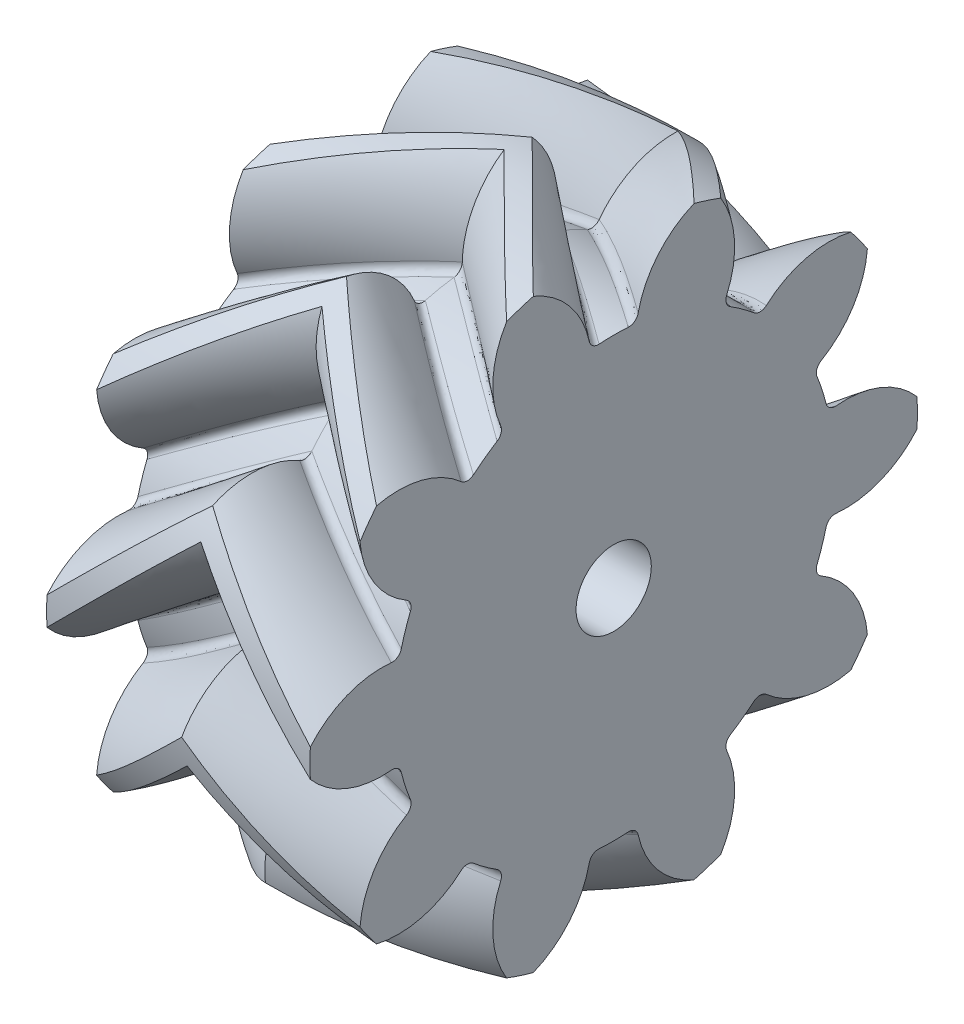
from build123d import *

# Parameters (mm, degrees)
BASPROSKE_W            = 7
BASPROSKE_H            = 16.142135624
TOOTHCUTLH_PITCH       = 101.424029378
TOOTHCUTLH_HEIGHT      = 7
TOOTHCUTLH_RADIUS      = 16.142135624
TOOTHCUTLH_START_ANGLE = -90
TEETHCUTSLH_COUNT      = 10
TEETHCUTSLH_ANGLE      = 324
BORSKE_R               = 2
BORE_DEPTH             = 62.5000025


with BuildPart() as part:
    # BasProSke → Base-Revolve (revolve)
    with BuildSketch(Plane(origin=(0, 0, 0), x_dir=(1, 0, 0), z_dir=(0, 1, 0)), mode=Mode.PRIVATE) as base_revolve_sk:
        with Locations((3.5, 8.071067812)):
            Rectangle(BASPROSKE_W, BASPROSKE_H)
    revolve(base_revolve_sk.sketch.rotate(Axis((-10, 0, 0), (1, 0, 0)), 180), axis=Axis((-10, 0, 0), (1, 0, 0)))

    # ToothCutLH: sweep along a helix
    with BuildLine() as toothcutlh_path:
        add(Helix(TOOTHCUTLH_PITCH, TOOTHCUTLH_HEIGHT, TOOTHCUTLH_RADIUS, center=(0, 0, 0), direction=(1, 0, 0), lefthand=True, mode=Mode.PRIVATE).rotate(Axis((0, 0, 0), (1, 0, 0)), TOOTHCUTLH_START_ANGLE))
    # TooCutSkeRH<3> → ToothCutLH (sweep, cut)
    with BuildSketch(Plane(origin=(0, 0, 0), x_dir=(0, 0, -1), z_dir=(1, 0, 0))):
        with BuildLine():
            ThreePointArc((0.777485713, 11.616145568), (0, 11.642135624), (-0.777485713, 11.616145568))
            ThreePointArc((-0.777485713, 11.616145568), (-1.112111143, 11.715653474), (-1.300501675, 12.009566742))
            ThreePointArc((-1.300501675, 12.009566742), (-2.640329527, 14.472142614), (-5.094931674, 15.826523243))
            ThreePointArc((-5.094931674, 15.826523243), (0, 16.626399692), (5.094931674, 15.826523243))
            ThreePointArc((5.094931674, 15.826523243), (2.640329527, 14.472142614), (1.300501675, 12.009566742))
            ThreePointArc((1.300501675, 12.009566742), (1.112111143, 11.715653474), (0.777485713, 11.616145568))
        make_face()
    toothcutlh = sweep(path=toothcutlh_path.line, is_frenet=True, mode=Mode.SUBTRACT)

    # TeethCutsLH: ToothCutLH ×10 about axis
    teethcutslh_axis = Axis((-10, 0, 0), (1, 0, 0))
    for i in range(1, TEETHCUTSLH_COUNT):
        add(toothcutlh.rotate(teethcutslh_axis, i * TEETHCUTSLH_ANGLE / (TEETHCUTSLH_COUNT - 1)), mode=Mode.SUBTRACT)

    # BorSke → Bore (cut, symmetric)
    with BuildSketch(Plane(origin=(0, 0, 0), x_dir=(0, 0, -1), z_dir=(1, 0, 0))):
        with Locations(Location((0, 0, 0), (0, 0, 180))):
            Circle(BORSKE_R)
    extrude(amount=BORE_DEPTH, both=True, mode=Mode.SUBTRACT)

    # Simetría1: part across plane


with BuildPart() as part_1:
    add(part.part)
    add(part.part.mirror(Plane.ZY.offset(-7)))


solid = part_1.part
